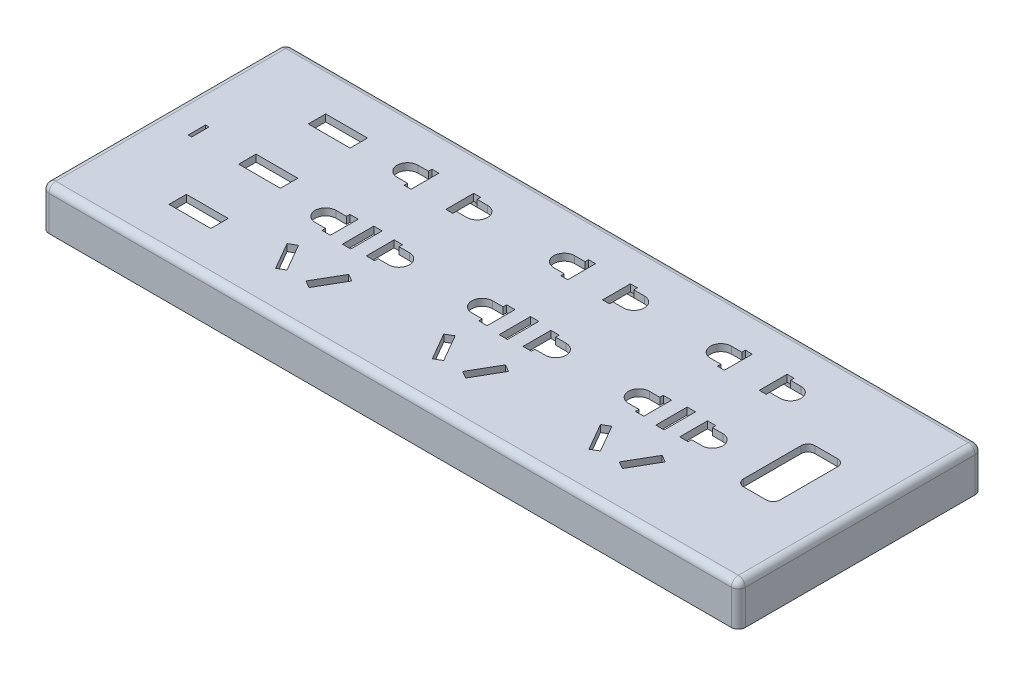
from build123d import *

# Parameters (mm, degrees)
RECTANGLEBOX_DEPTH      = 2
RECTANGLEBOX_DEPTH_BACK = 10
SKETCHREC_W             = 200
SKETCHREC_H             = 70
RECTANGLER_R            = 2
RECTANGLEC_START        = -98
RECTANGLEC_OUTLINE_W    = 10
RECTANGLEC_OUTLINE_H    = 66
RECTANGLEC_DEPTH        = 196
FBUTTONCUT_DEPTH        = 107.625512894
SLEDCUT_W               = 1
SLEDCUT_H               = 5
FLEDCUT_DEPTH           = 107.625512894
SSLOTA_W                = 2.4
SSLOTA_H                = 9
FSLOTACUT_DEPTH         = 107.625512894
SSLOTA2_W               = 2.4
SSLOTA2_H               = 9
FSLOTA2CUT_DEPTH        = 107.625512894
SSLOTA3_W               = 2.4
SSLOTA3_H               = 9
FSLOTA3CUT_DEPTH        = 107.625512894
FSLOTBCUT_DEPTH         = 107.625512894
FSLOTB2CUT_DEPTH        = 107.625512894
FSLOTB3CUT_DEPTH        = 107.625512894
SSLOTC_W                = 12
SSLOTC_H                = 5
FSLOTCCUT_DEPTH         = 107.625512894
SSLOTC2_W               = 12
SSLOTC2_H               = 5
FSLOTC2CUT_DEPTH        = 107.625512894
SSLOTC3_W               = 12
SSLOTC3_H               = 5
FSLOTC3CUT_DEPTH        = 107.625512894


# Read off the part's stored shape, not the designer's step: RectangleC
with BuildPart() as part:
    # SketchRec → RectangleBox (new, two sides: drawn at the far end of the back side and taken through both)
    with BuildSketch(Plane(origin=(0, 0, 0), x_dir=(1, 0, 0), z_dir=(0, 1, 0)).offset(-RECTANGLEBOX_DEPTH_BACK)):
        Rectangle(SKETCHREC_W, SKETCHREC_H)
    extrude(amount=RECTANGLEBOX_DEPTH + RECTANGLEBOX_DEPTH_BACK)

    # RectangleR
    rectangler_edges = [part.edges().sort_by_distance(p)[0] for p in [
        (100, 2, 0),
        (0, 2, -35),
        (-100, 2, 0),
        (0, 2, 35),
        (100, -4, 35),
        (-100, -4, 35),
        (-100, -4, -35),
        (100, -4, -35),
    ]]
    fillet(rectangler_edges, radius=RECTANGLER_R)

    # RectangleC outline → RectangleC (cut)
    with BuildSketch(Plane.YZ.offset(RECTANGLEC_START)):
        with Locations((-5, 0)):
            Rectangle(RECTANGLEC_OUTLINE_W, RECTANGLEC_OUTLINE_H)
    extrude(amount=RECTANGLEC_DEPTH, mode=Mode.SUBTRACT)

    # SButtonCut → FButtonCut (cut, through all)
    with BuildSketch(Plane(origin=(0, -10, 0), x_dir=(1, 0, 0), z_dir=(0, 1, 0))):
        with BuildLine():
            Line((83.25, 10.25), (76.75, 10.25))
            ThreePointArc((76.75, 10.25), (75.335786438, 9.664213562), (74.75, 8.25))
            Line((74.75, 8.25), (74.75, -8.25))
            ThreePointArc((74.75, -8.25), (75.335786438, -9.664213562), (76.75, -10.25))
            Line((76.75, -10.25), (83.25, -10.25))
            ThreePointArc((83.25, -10.25), (84.664213562, -9.664213562), (85.25, -8.25))
            Line((85.25, -8.25), (85.25, 8.25))
            ThreePointArc((85.25, 8.25), (84.664213562, 9.664213562), (83.25, 10.25))
        make_face()
    extrude(amount=FBUTTONCUT_DEPTH, mode=Mode.SUBTRACT)

    # SLEDCut → FLEDCut (cut, through all)
    with BuildSketch(Plane(origin=(0, -10, 0), x_dir=(1, 0, 0), z_dir=(0, 1, 0))):
        with Locations((-90, 0)):
            Rectangle(SLEDCUT_W, SLEDCUT_H)
    extrude(amount=FLEDCUT_DEPTH, mode=Mode.SUBTRACT)

    # SSlotA → FSlotACut (cut, through all)
    with BuildSketch(Plane(origin=(0, -10, 0), x_dir=(1, 0, 0), z_dir=(0, 1, 0))):
        with BuildLine():
            Line((-45.15, -7), (-45.15, 1))
            Line((-45.15, 1), (-47.55, 1))
            Line((-47.55, 1), (-47.55, 0))
            Line((-47.55, 0), (-50.55, 0))
            ThreePointArc((-50.55, 0), (-53.55, -3), (-50.55, -6))
            Line((-50.55, -6), (-47.55, -6))
            Line((-47.55, -6), (-47.55, -7))
            Line((-47.55, -7), (-45.15, -7))
        make_face()
        with Locations((-40, -3)):
            Rectangle(SSLOTA_W, SSLOTA_H)
        with BuildLine():
            Line((-32.45, 0), (-32.45, 1))
            Line((-32.45, 1), (-34.85, 1))
            Line((-34.85, 1), (-34.85, -7))
            Line((-34.85, -7), (-32.45, -7))
            Line((-32.45, -7), (-32.45, -6))
            Line((-32.45, -6), (-29.45, -6))
            ThreePointArc((-29.45, -6), (-26.45, -3), (-29.45, 0))
            Line((-29.45, 0), (-32.45, 0))
        make_face()
        Polygon((-37.283121635, -21.894228634), (-35.204660666, -23.094228634), (-30.704660666, -15.3), (-32.783121635, -14.1), align=None)
        Polygon((-49.295339334, -15.3), (-44.795339334, -23.094228634), (-42.716878365, -21.894228634), (-47.216878365, -14.1), align=None)
    extrude(amount=FSLOTACUT_DEPTH, mode=Mode.SUBTRACT)

    # SSlotA2 → FSlotA2Cut (cut, through all)
    with BuildSketch(Plane(origin=(0, -10, 0), x_dir=(1, 0, 0), z_dir=(0, 1, 0))):
        with BuildLine():
            Line((-0.15, -7), (-0.15, 1))
            Line((-0.15, 1), (-2.55, 1))
            Line((-2.55, 1), (-2.55, 0))
            Line((-2.55, 0), (-5.55, 0))
            ThreePointArc((-5.55, 0), (-8.55, -3), (-5.55, -6))
            Line((-5.55, -6), (-2.55, -6))
            Line((-2.55, -6), (-2.55, -7))
            Line((-2.55, -7), (-0.15, -7))
        make_face()
        with Locations((5, -3)):
            Rectangle(SSLOTA2_W, SSLOTA2_H)
        with BuildLine():
            Line((12.55, 0), (12.55, 1))
            Line((12.55, 1), (10.15, 1))
            Line((10.15, 1), (10.15, -7))
            Line((10.15, -7), (12.55, -7))
            Line((12.55, -7), (12.55, -6))
            Line((12.55, -6), (15.55, -6))
            ThreePointArc((15.55, -6), (18.55, -3), (15.55, 0))
            Line((15.55, 0), (12.55, 0))
        make_face()
        Polygon((7.716878365, -21.894228634), (9.795339334, -23.094228634), (14.295339334, -15.3), (12.216878365, -14.1), align=None)
        Polygon((-4.295339334, -15.3), (0.204660666, -23.094228634), (2.283121635, -21.894228634), (-2.216878365, -14.1), align=None)
    extrude(amount=FSLOTA2CUT_DEPTH, mode=Mode.SUBTRACT)

    # SSlotA3 → FSlotA3Cut (cut, through all)
    with BuildSketch(Plane(origin=(0, -10, 0), x_dir=(1, 0, 0), z_dir=(0, 1, 0))):
        with BuildLine():
            Line((44.85, -7), (44.85, 1))
            Line((44.85, 1), (42.45, 1))
            Line((42.45, 1), (42.45, 0))
            Line((42.45, 0), (39.45, 0))
            ThreePointArc((39.45, 0), (36.45, -3), (39.45, -6))
            Line((39.45, -6), (42.45, -6))
            Line((42.45, -6), (42.45, -7))
            Line((42.45, -7), (44.85, -7))
        make_face()
        with Locations((50, -3)):
            Rectangle(SSLOTA3_W, SSLOTA3_H)
        with BuildLine():
            Line((57.55, 0), (57.55, 1))
            Line((57.55, 1), (55.15, 1))
            Line((55.15, 1), (55.15, -7))
            Line((55.15, -7), (57.55, -7))
            Line((57.55, -7), (57.55, -6))
            Line((57.55, -6), (60.55, -6))
            ThreePointArc((60.55, -6), (63.55, -3), (60.55, 0))
            Line((60.55, 0), (57.55, 0))
        make_face()
        Polygon((52.716878365, -21.894228634), (54.795339334, -23.094228634), (59.295339334, -15.3), (57.216878365, -14.1), align=None)
        Polygon((40.704660666, -15.3), (45.204660666, -23.094228634), (47.283121635, -21.894228634), (42.783121635, -14.1), align=None)
    extrude(amount=FSLOTA3CUT_DEPTH, mode=Mode.SUBTRACT)

    # SSlotB → FSlotBCut (cut, through all)
    with BuildSketch(Plane(origin=(0, -10, 0), x_dir=(1, 0, 0), z_dir=(0, 1, 0))):
        with BuildLine():
            Line((-45, 16), (-45, 24))
            Line((-45, 24), (-47, 24))
            Line((-47, 24), (-47, 23))
            Line((-47, 23), (-50, 23))
            ThreePointArc((-50, 23), (-53, 20), (-50, 17))
            Line((-50, 17), (-47, 17))
            Line((-47, 17), (-47, 16))
            Line((-47, 16), (-45, 16))
        make_face()
        with BuildLine():
            Line((-33, 17), (-30, 17))
            ThreePointArc((-30, 17), (-27, 20), (-30, 23))
            Line((-30, 23), (-33, 23))
            Line((-33, 23), (-33, 24))
            Line((-33, 24), (-35, 24))
            Line((-35, 24), (-35, 16))
            Line((-35, 16), (-33, 16))
            Line((-33, 16), (-33, 17))
        make_face()
    extrude(amount=FSLOTBCUT_DEPTH, mode=Mode.SUBTRACT)

    # SSlotB2 → FSlotB2Cut (cut, through all)
    with BuildSketch(Plane(origin=(0, -10, 0), x_dir=(1, 0, 0), z_dir=(0, 1, 0))):
        with BuildLine():
            Line((0, 16), (0, 24))
            Line((0, 24), (-2, 24))
            Line((-2, 24), (-2, 23))
            Line((-2, 23), (-5, 23))
            ThreePointArc((-5, 23), (-8, 20), (-5, 17))
            Line((-5, 17), (-2, 17))
            Line((-2, 17), (-2, 16))
            Line((-2, 16), (0, 16))
        make_face()
        with BuildLine():
            Line((12, 17), (15, 17))
            ThreePointArc((15, 17), (18, 20), (15, 23))
            Line((15, 23), (12, 23))
            Line((12, 23), (12, 24))
            Line((12, 24), (10, 24))
            Line((10, 24), (10, 16))
            Line((10, 16), (12, 16))
            Line((12, 16), (12, 17))
        make_face()
    extrude(amount=FSLOTB2CUT_DEPTH, mode=Mode.SUBTRACT)

    # SSlotB3 → FSlotB3Cut (cut, through all)
    with BuildSketch(Plane(origin=(0, -10, 0), x_dir=(1, 0, 0), z_dir=(0, 1, 0))):
        with BuildLine():
            Line((45, 16), (45, 24))
            Line((45, 24), (43, 24))
            Line((43, 24), (43, 23))
            Line((43, 23), (40, 23))
            ThreePointArc((40, 23), (37, 20), (40, 17))
            Line((40, 17), (43, 17))
            Line((43, 17), (43, 16))
            Line((43, 16), (45, 16))
        make_face()
        with BuildLine():
            Line((57, 17), (60, 17))
            ThreePointArc((60, 17), (63, 20), (60, 23))
            Line((60, 23), (57, 23))
            Line((57, 23), (57, 24))
            Line((57, 24), (55, 24))
            Line((55, 24), (55, 16))
            Line((55, 16), (57, 16))
            Line((57, 16), (57, 17))
        make_face()
    extrude(amount=FSLOTB3CUT_DEPTH, mode=Mode.SUBTRACT)

    # SSlotC → FSlotCCut (cut, through all)
    with BuildSketch(Plane(origin=(0, -10, 0), x_dir=(1, 0, 0), z_dir=(0, 1, 0))):
        with Locations((-70, 20)):
            Rectangle(SSLOTC_W, SSLOTC_H)
    extrude(amount=FSLOTCCUT_DEPTH, mode=Mode.SUBTRACT)

    # SSlotC2 → FSlotC2Cut (cut, through all)
    with BuildSketch(Plane(origin=(0, -10, 0), x_dir=(1, 0, 0), z_dir=(0, 1, 0))):
        with Locations((-70, 0)):
            Rectangle(SSLOTC2_W, SSLOTC2_H)
    extrude(amount=FSLOTC2CUT_DEPTH, mode=Mode.SUBTRACT)

    # SSlotC3 → FSlotC3Cut (cut, through all)
    with BuildSketch(Plane(origin=(0, -10, 0), x_dir=(1, 0, 0), z_dir=(0, 1, 0))):
        with Locations((-70, -20)):
            Rectangle(SSLOTC3_W, SSLOTC3_H)
    extrude(amount=FSLOTC3CUT_DEPTH, mode=Mode.SUBTRACT)


solid = part.part
